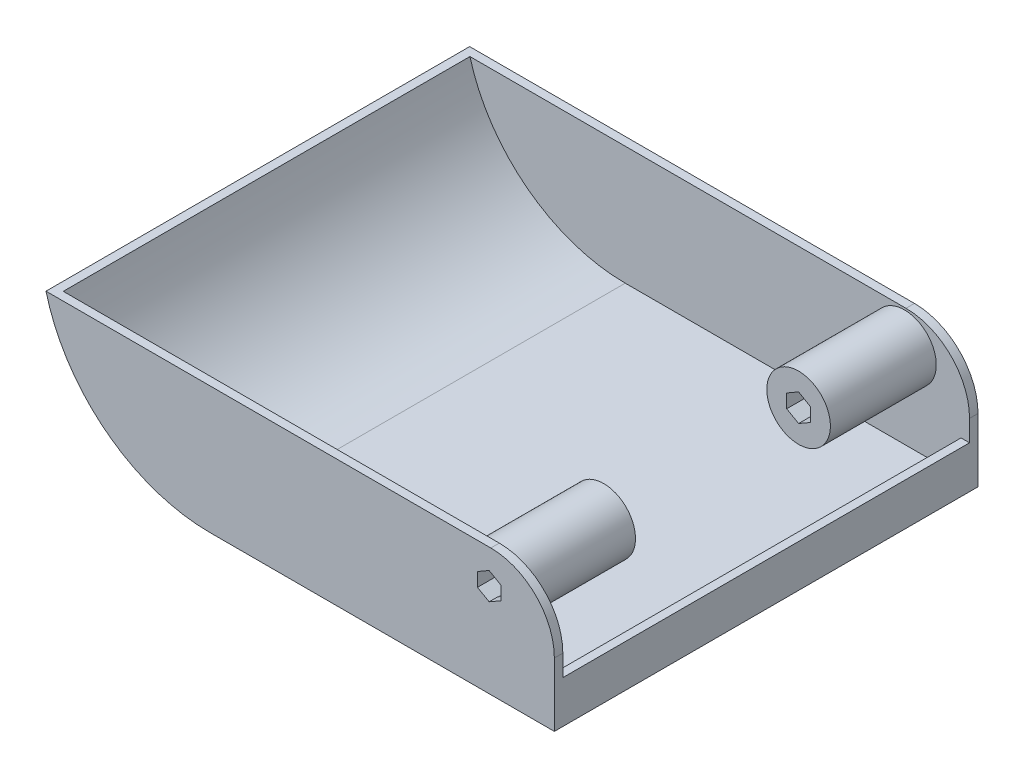
from build123d import *

# Parameters (mm, degrees)
SKETCH1_W               = 152.4
SKETCH1_H               = 127
BOSS_EXTRUDE1_DEPTH     = 38.1
FILLET1_R               = 50.8
SHELL1_T                = -2.54
CUT_EXTRUDE2_DEPTH      = 151.825533647
CUT_EXTRUDE2_DEPTH_BACK = 151.825533647
SKETCH4_R               = 9.525
BOSS_EXTRUDE2_DEPTH     = 124.46
SKETCH2_W               = 11.613456366
SKETCH2_H               = 121.92
CUT_EXTRUDE3_DEPTH      = 25.4
SKETCH5_W               = 29.081811675
SKETCH5_H               = 58.42
CUT_EXTRUDE4_DEPTH      = 50.8
FILLET3_R               = 19.05


with BuildPart() as part:
    # Sketch1 → Boss-Extrude1 (new body)
    with BuildSketch(Plane(origin=(0, 0, 0), x_dir=(1, 0, 0), z_dir=(0, 1, 0))):
        Rectangle(SKETCH1_W, SKETCH1_H)
    extrude(amount=BOSS_EXTRUDE1_DEPTH)

    # Fillet1
    # the kernel refuses this fillet: 50.8 mm, written as the material it takes off along each edge
    with BuildSketch(Plane(origin=(-76.2, 0, -186.467221242), x_dir=(0, 1, 0), z_dir=(0, 0, 1))) as fillet1_piece_1:
        with BuildLine():
            CenterArc((50.8, -49.186888497), FILLET1_R, 104.477512186, 75.522487814)
            Line((0, -49.186888497), (-1.016, -49.186888497))
            Line((-1.016, -49.186888497), (-1.016, 0))
            Line((-1.016, 0), (0, 1.016))
            ThreePointArc((0, 1.016), (19.05, 1.016), (37.846, 0.98373777))
            Line((37.846, 0.98373777), (38.1, 0))
        make_face()
    extrude(amount=372.934442484, mode=Mode.SUBTRACT)

    # Shell1
    shell1_openings = [part.faces().sort_by_distance(p)[0] for p in [
        (0, 38.1, 0),
    ]]
    offset(amount=SHELL1_T, openings=shell1_openings, kind=Kind.INTERSECTION)

    # Sketch3 → Cut-Extrude2 (cut, two sides: drawn at the far end of the back side and taken through both)
    with BuildSketch(Plane.XY.offset(-60.96).offset(-CUT_EXTRUDE2_DEPTH_BACK)):
        Polygon((56.572208389, 32.046115114), (53.016208389, 29.993057557), (53.016208389, 25.886942443), (56.572208389, 23.833884886), (60.128208389, 25.886942443), (60.128208389, 29.993057557), align=None)
    extrude(amount=CUT_EXTRUDE2_DEPTH + CUT_EXTRUDE2_DEPTH_BACK, mode=Mode.SUBTRACT)

    # Sketch4 → Boss-Extrude2 (add)
    with BuildSketch(Plane.XY.offset(-60.96)):
        with Locations(Location((56.706906113, 27.94, 0), (0, 0, 180))):
            Circle(SKETCH4_R)
        Polygon((56.706906113, 32.046115114), (53.150906113, 29.993057557), (53.150906113, 25.886942443), (56.706906113, 23.833884886), (60.262906113, 25.886942443), (60.262906113, 29.993057557), align=None, mode=Mode.SUBTRACT)
    extrude(amount=BOSS_EXTRUDE2_DEPTH)

    # Sketch2 → Cut-Extrude3 (cut)
    with BuildSketch(Plane(origin=(0, 38.1, 0), x_dir=(1, 0, 0), z_dir=(0, 1, 0))):
        with Locations((78.243168089, 0)):
            Rectangle(SKETCH2_W, SKETCH2_H)
    extrude(amount=-CUT_EXTRUDE3_DEPTH, mode=Mode.SUBTRACT)

    # Sketch5 → Cut-Extrude4 (cut)
    with BuildSketch(Plane(origin=(0, 2.54, 0), x_dir=(1, 0, 0), z_dir=(0, 1, 0))):
        with Locations((53.93192453, 0)):
            Rectangle(SKETCH5_W, SKETCH5_H)
    extrude(amount=CUT_EXTRUDE4_DEPTH, mode=Mode.SUBTRACT)

    # Fillet3
    fillet3_edges = [part.edges().sort_by_distance(p)[0] for p in [
        (76.2, 38.1, 62.23),
        (76.2, 38.1, -62.23),
    ]]
    fillet(fillet3_edges, radius=FILLET3_R)


solid = part.part
